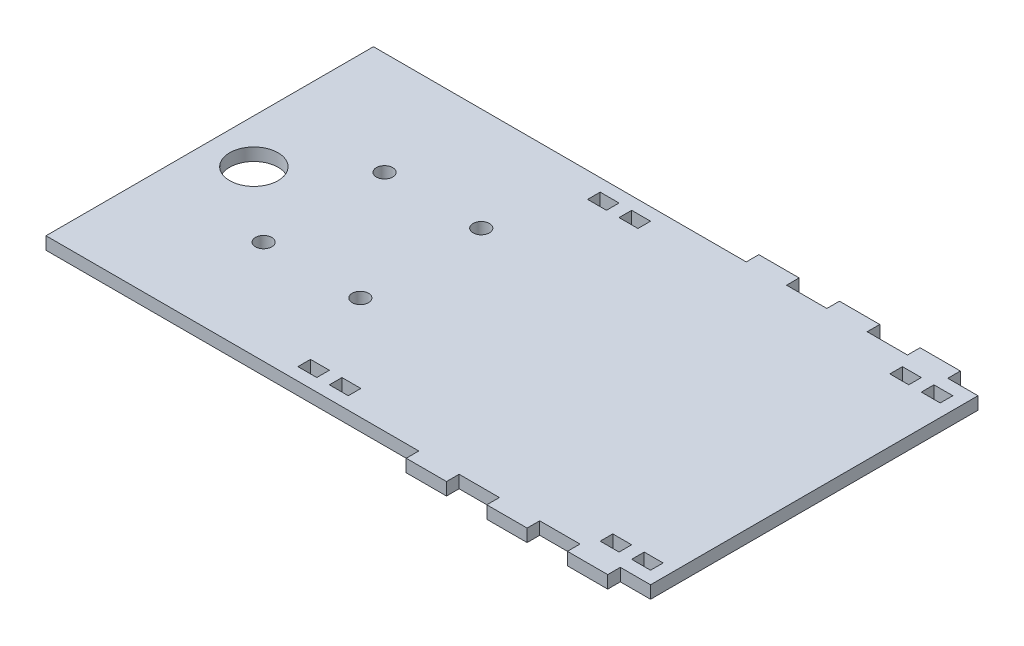
from build123d import *

# Parameters (mm, degrees)
SKETCH1_R                   = 6.096
BOSS_EXTRUDE1_DEPTH         = 3.175
SKETCH2_R                   = 2.06375
CASTER_MOUNTING_HOLES_DEPTH = 89.274136218
SKETCH3_W                   = 4.7625
SKETCH3_H                   = 3.175
CUT_EXTRUDE1_DEPTH          = 89.274136218
LPATTERN1_COUNT             = 2
LPATTERN1_PITCH             = 76.2
LPATTERN1_COUNT_DIR2        = 2
LPATTERN1_PITCH_DIR2        = 73.025


with BuildPart() as part:
    # Sketch1 → Boss-Extrude1 (new body)
    with BuildSketch(Plane(origin=(0, 0, 0), x_dir=(1, 0, 0), z_dir=(0, 1, 0))):
        Polygon((27.94, -41.275), (38.1, -41.275), (38.1, -44.45), (48.26, -44.45), (48.26, -41.275), (58.42, -41.275), (58.42, -44.45), (68.58, -44.45), (68.58, -41.275), (76.2, -41.275), (76.2, 41.275), (68.58, 41.275), (68.58, 44.45), (58.42, 44.45), (58.42, 41.275), (48.26, 41.275), (48.26, 44.45), (38.1, 44.45), (38.1, 41.275), (27.94, 41.275), (27.94, 44.45), (17.78, 44.45), (17.78, 41.275), (-76.2, 41.275), (-76.2, -41.275), (17.78, -41.275), (17.78, -44.45), (27.94, -44.45), align=None)
        with Locations((-65.076590574, 0)):
            Circle(SKETCH1_R, mode=Mode.SUBTRACT)
    extrude(amount=BOSS_EXTRUDE1_DEPTH)

    # Sketch2 → Caster Mounting Holes (cut, through all)
    with BuildSketch(Plane(origin=(0, 3.175, 0), x_dir=(1, 0, 0), z_dir=(0, 1, 0))):
        with Locations((-47.3754273, 15.24)):
            Circle(SKETCH2_R)
        with Locations((-22.9914273, 15.24)):
            Circle(SKETCH2_R)
        with Locations((-22.9914273, -15.24)):
            Circle(SKETCH2_R)
        with Locations((-47.3754273, -15.24)):
            Circle(SKETCH2_R)
    extrude(amount=-CASTER_MOUNTING_HOLES_DEPTH, mode=Mode.SUBTRACT)

    # Sketch3 → Cut-Extrude1 (cut, through all)
    with BuildSketch(Plane(origin=(0, 3.175, 0), x_dir=(1, 0, 0), z_dir=(0, 1, 0))):
        with Locations((62.70625, 36.5125)):
            Rectangle(SKETCH3_W, SKETCH3_H)
        with Locations((70.64375, 36.5125)):
            Rectangle(SKETCH3_W, SKETCH3_H)
    cut_extrude1 = extrude(amount=-CUT_EXTRUDE1_DEPTH, mode=Mode.SUBTRACT)

    # LPattern1: Cut-Extrude1 2 × 2
    with Locations(*[(-i * LPATTERN1_PITCH, 0, j * LPATTERN1_PITCH_DIR2) for i in range(LPATTERN1_COUNT) for j in range(LPATTERN1_COUNT_DIR2) if (i, j) != (0, 0)]):
        add(cut_extrude1, mode=Mode.SUBTRACT)


solid = part.part
